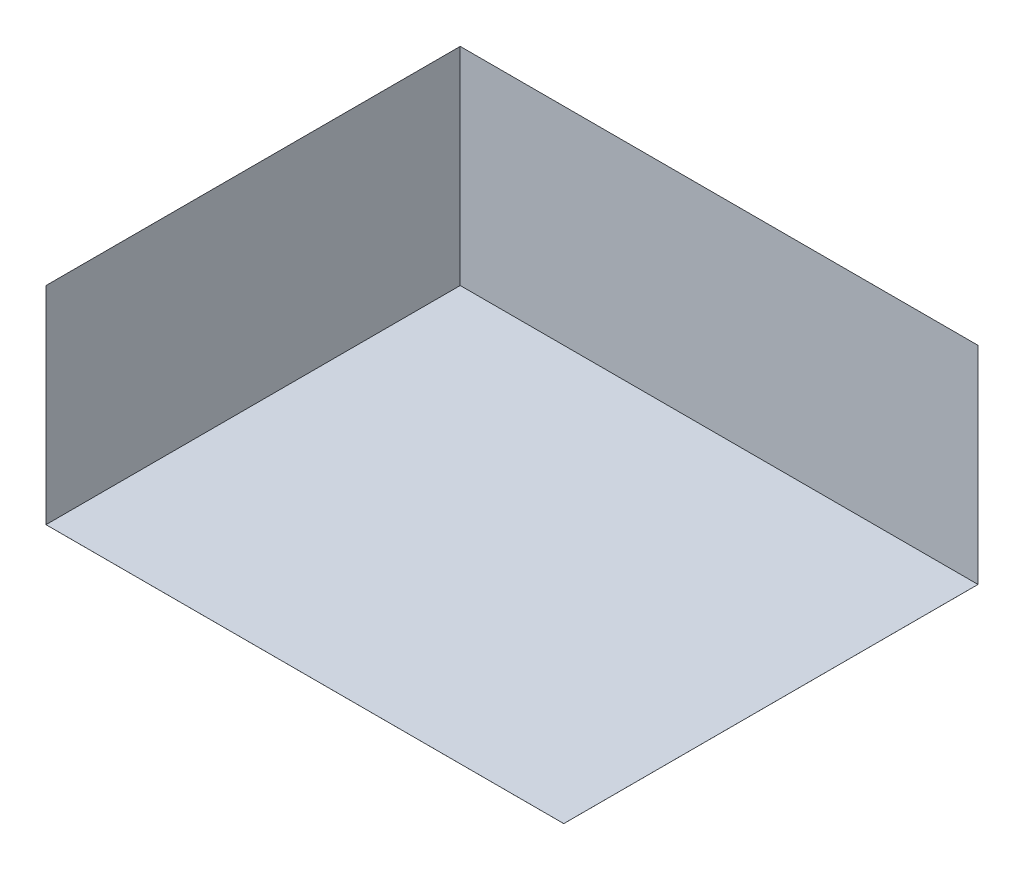
from build123d import *

# Parameters (mm, degrees)
SKETCH2_W     = 5000
SKETCH2_H     = 4000
FLOOR_2_DEPTH = 0.254
SKETCH3_W     = 5000
SKETCH3_H     = 0.0254
WALL1_DEPTH   = 2000
SKETCH4_W     = 0.0254
SKETCH4_H     = 4000
WALL2_DEPTH   = 2000


with BuildPart() as part:
    # Sketch2 → Floor 2 (new body)
    with BuildSketch(Plane(origin=(0, 0, 0), x_dir=(1, 0, 0), z_dir=(0, 1, 0))):
        with Locations((2446.679895561, -1980.502349869)):
            Rectangle(SKETCH2_W, SKETCH2_H)
    extrude(amount=FLOOR_2_DEPTH)


with BuildPart() as body_2:
    # Sketch3 → Wall1 (new body)
    with BuildSketch(Plane(origin=(0, 0.254, 0), x_dir=(1, 0, 0), z_dir=(0, 1, 0))):
        with Locations((2446.679895561, 19.510350131)):
            Rectangle(SKETCH3_W, SKETCH3_H)
    extrude(amount=WALL1_DEPTH)


with BuildPart() as body_3:
    # Sketch4 → Wall2 (new body)
    with BuildSketch(Plane(origin=(0, 0.254, 0), x_dir=(1, 0, 0), z_dir=(0, 1, 0))):
        with Locations((-53.332804439, -1980.502349869)):
            Rectangle(SKETCH4_W, SKETCH4_H)
    extrude(amount=WALL2_DEPTH)


solid = Compound([part.part, body_2.part, body_3.part])
